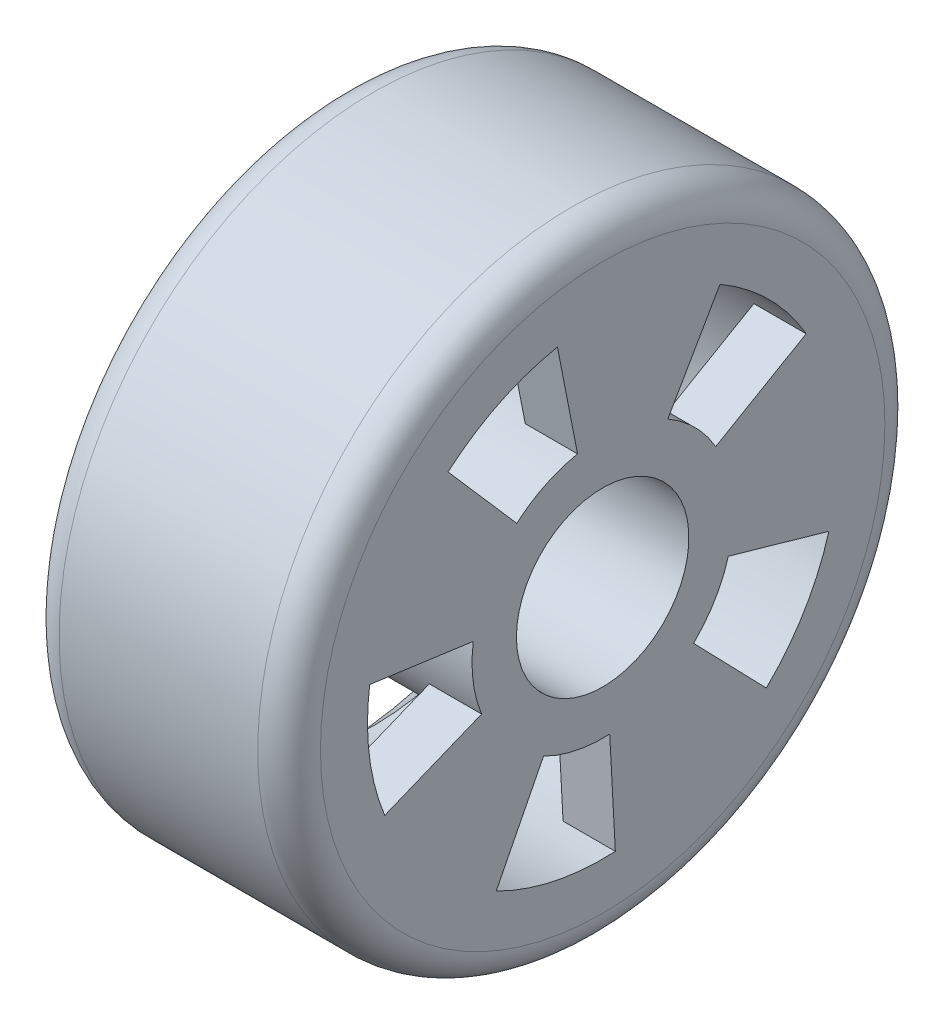
from build123d import *
from build123d.topology import SkipClean

# Parameters (mm, degrees)
SKETCH1_R           = 30
BOSS_EXTRUDE1_DEPTH = 25
FILLET1_R           = 3
SKETCH3_R           = 22.5
CUT_EXTRUDE1_DEPTH  = 20
CHAMFER1_SIZE       = 3
CUT_EXTRUDE2_DEPTH  = 50.244289131
CIRPATTERN1_COUNT   = 5
CIRPATTERN1_ANGLE   = 284
SKETCH4_R           = 12.5
BOSS_EXTRUDE2_DEPTH = 15
SKETCH5_R           = 8.25
CUT_EXTRUDE3_DEPTH  = 47.904157726
SKETCH6_R           = 10
SKETCH6_R_2         = 5
BOSS_EXTRUDE3_DEPTH = 3


with BuildPart() as part:
    # Sketch1 → Boss-Extrude1 (new body)
    with BuildSketch(Plane(origin=(0, 0, 0), x_dir=(0, 0, -1), z_dir=(1, 0, 0))):
        Circle(SKETCH1_R)
    extrude(amount=BOSS_EXTRUDE1_DEPTH)

    # Fillet1
    fillet1_edges = [part.edges().sort_by_distance(p)[0] for p in [
        (0, 0, 30),
        (25, 0, 30),
    ]]
    fillet(fillet1_edges, radius=FILLET1_R)

    # Sketch3 → Cut-Extrude1 (cut)
    with BuildSketch(Plane.ZY):
        Circle(SKETCH3_R)
    extrude(amount=-CUT_EXTRUDE1_DEPTH, mode=Mode.SUBTRACT)

    # Chamfer1
    chamfer1_edges = [part.edges().sort_by_distance(p)[0] for p in [
        (0, 0, -22.5),
    ]]
    chamfer(chamfer1_edges, length=CHAMFER1_SIZE)

    # Sketch2 → Cut-Extrude2 (cut, through all)
    with BuildSketch(Plane.ZY.offset(-25)):
        with BuildLine():
            Line((-6.233158363, 10.835023619), (-11.219685054, 19.503042514))
            ThreePointArc((-11.219685054, 19.503042514), (-15.885142396, 15.934624283), (-19.468053536, 11.280287741))
            Line((-19.468053536, 11.280287741), (-10.815585298, 6.266826523))
            ThreePointArc((-10.815585298, 6.266826523), (-8.825079109, 8.852569046), (-6.233158363, 10.835023619))
        make_face()
    cut_extrude2 = extrude(amount=CUT_EXTRUDE2_DEPTH, mode=Mode.SUBTRACT)

    # CirPattern1: Cut-Extrude2 ×5 about axis
    with SkipClean():  # the faces are left unmerged after this step: merging them gives an invalid solid
        cirpattern1_axis = Axis((25, 0, 0), (1, 0, 0))
        for i in range(1, CIRPATTERN1_COUNT):
            add(cut_extrude2.rotate(cirpattern1_axis, i * CIRPATTERN1_ANGLE / (CIRPATTERN1_COUNT - 1)), mode=Mode.SUBTRACT)
    add(part.part.scale(1), mode=Mode.REPLACE)  # the faces are merged on a copy

    # Sketch4 → Boss-Extrude2 (add)
    with BuildSketch(Plane.ZY.offset(-20)):
        Circle(SKETCH4_R)
    extrude(amount=BOSS_EXTRUDE2_DEPTH)

    # Sketch5 → Cut-Extrude3 (cut, through all)
    with BuildSketch(Plane.ZY.offset(-5)):
        Circle(SKETCH5_R)
    extrude(amount=-CUT_EXTRUDE3_DEPTH, mode=Mode.SUBTRACT)

    # Sketch6 → Boss-Extrude3 (add)
    with BuildSketch(Plane.ZY.offset(-5)):
        Circle(SKETCH6_R)
        Circle(SKETCH6_R_2, mode=Mode.SUBTRACT)
    extrude(amount=-BOSS_EXTRUDE3_DEPTH)


solid = part.part
